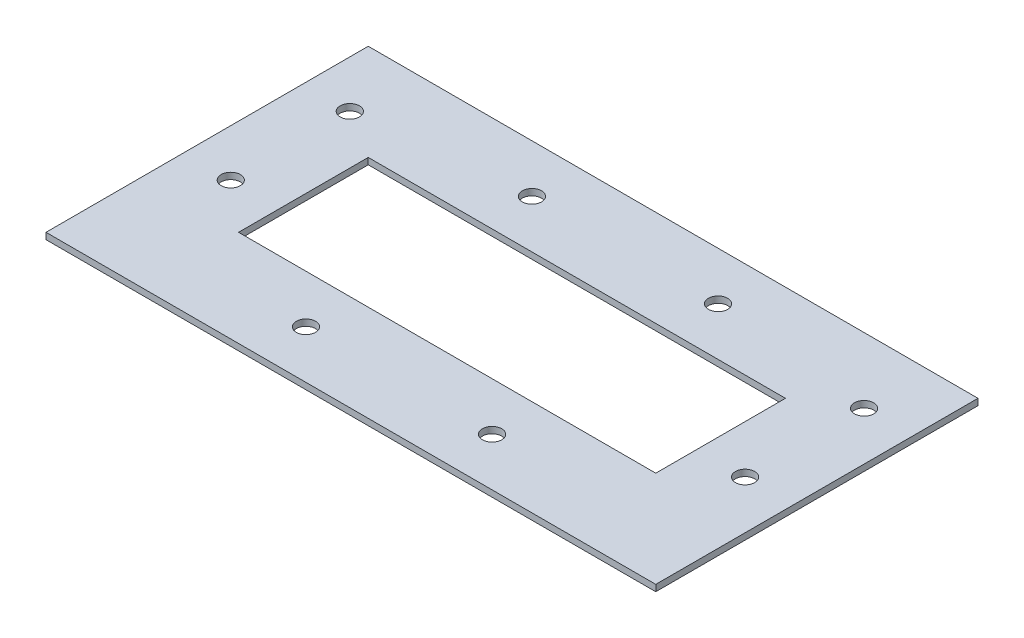
from build123d import *

# Parameters (mm, degrees)
SKETCH2_W           = 94.999999992
SKETCH2_H           = 50.20499992
SKETCH2_R           = 1.5
SKETCH2_W_2         = 64.999999992
SKETCH2_H_2         = 20.20499992
BOSS_EXTRUDE2_DEPTH = 1


with BuildPart() as part:
    # Sketch2 → Boss-Extrude2 (new body)
    with BuildSketch(Plane(origin=(0, 0, 0), x_dir=(1, 0, 0), z_dir=(0, 1, 0))):
        Rectangle(SKETCH2_W, SKETCH2_H)
        with Locations((-14.499999996, 17.60249996)):
            Circle(SKETCH2_R, mode=Mode.SUBTRACT)
        with Locations((14.499999996, 17.60249996)):
            Circle(SKETCH2_R, mode=Mode.SUBTRACT)
        with Locations((-40.148974228, 14.877942076)):
            Circle(SKETCH2_R, mode=Mode.SUBTRACT)
        with Locations((-40.148974228, -3.666516508)):
            Circle(SKETCH2_R, mode=Mode.SUBTRACT)
        with Locations((39.978852734, 14.877942076)):
            Circle(SKETCH2_R, mode=Mode.SUBTRACT)
        with Locations((39.978852734, -3.666516508)):
            Circle(SKETCH2_R, mode=Mode.SUBTRACT)
        with Locations((-14.499999996, -17.60249996)):
            Circle(SKETCH2_R, mode=Mode.SUBTRACT)
        with Locations((14.499999996, -17.60249996)):
            Circle(SKETCH2_R, mode=Mode.SUBTRACT)
        Rectangle(SKETCH2_W_2, SKETCH2_H_2, mode=Mode.SUBTRACT)
    extrude(amount=BOSS_EXTRUDE2_DEPTH)


solid = part.part
